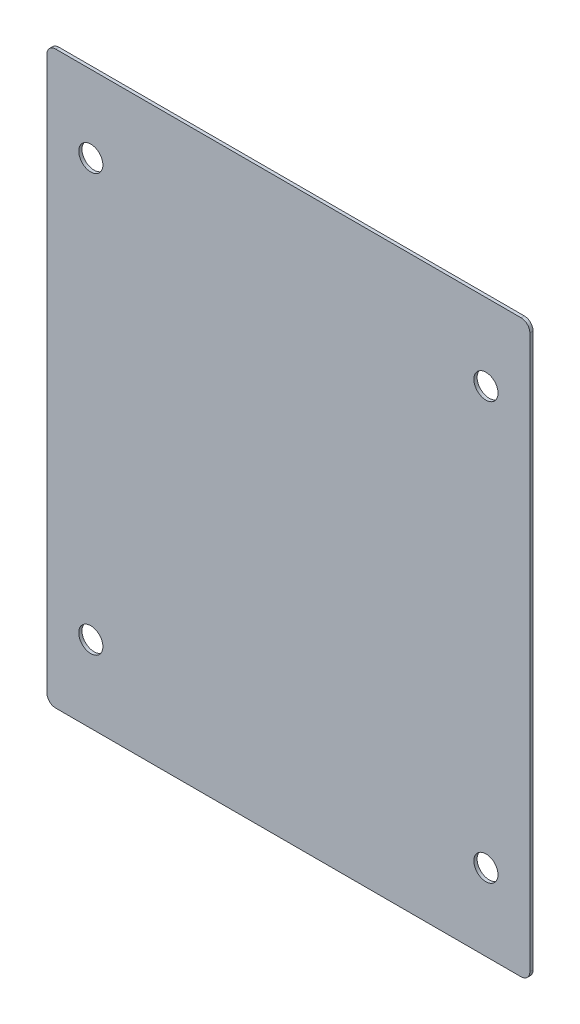
from build123d import *

# Parameters (mm, degrees)
ESQUISSE1_W               = 110
ESQUISSE1_H               = 130
T_LE_DE_BASE_PLI_E1_DEPTH = 0.7366
D_GAGEMENT_M51_D          = 5.5
COIN_BRIS_1_START         = -0.7366
COIN_BRIS_1_DEPTH         = 0.7366


# Read off the part's stored shape, not the designer's step: Coin-brisé1
# Sheet-metal steps are written as plain solids
with BuildPart() as part:
    # Esquisse1 → Tôle de base pliée1 (new body)
    with BuildSketch(Plane.XY):
        Rectangle(ESQUISSE1_W, ESQUISSE1_H)
    extrude(amount=-T_LE_DE_BASE_PLI_E1_DEPTH)

    # Dégagement M51 (through all)
    with Locations(Plane.XY):
        with Locations((-45, 47.5), (45, 47.5), (45, -47.5), (-45, -47.5)):
            Hole(D_GAGEMENT_M51_D / 2)

    # Coin-brisé1 outline → Coin-brisé1 (cut)
    with BuildSketch(Plane.XY.offset(COIN_BRIS_1_START)):
        with BuildLine():
            ThreePointArc((55, -63), (54.414213562, -64.414213562), (53, -65))
            Line((53, -65), (55, -65))
            Line((55, -65), (55, -63))
        make_face()
        with BuildLine():
            Line((-55, -65), (-53, -65))
            ThreePointArc((-53, -65), (-54.414213562, -64.414213562), (-55, -63))
            Line((-55, -63), (-55, -65))
        make_face()
        with BuildLine():
            ThreePointArc((53, 65), (54.414213562, 64.414213562), (55, 63))
            Line((55, 63), (55, 65))
            Line((55, 65), (53, 65))
        make_face()
        with BuildLine():
            Line((-55, 65), (-55, 63))
            ThreePointArc((-55, 63), (-54.414213562, 64.414213562), (-53, 65))
            Line((-53, 65), (-55, 65))
        make_face()
    extrude(amount=COIN_BRIS_1_DEPTH, mode=Mode.SUBTRACT)


solid = part.part
